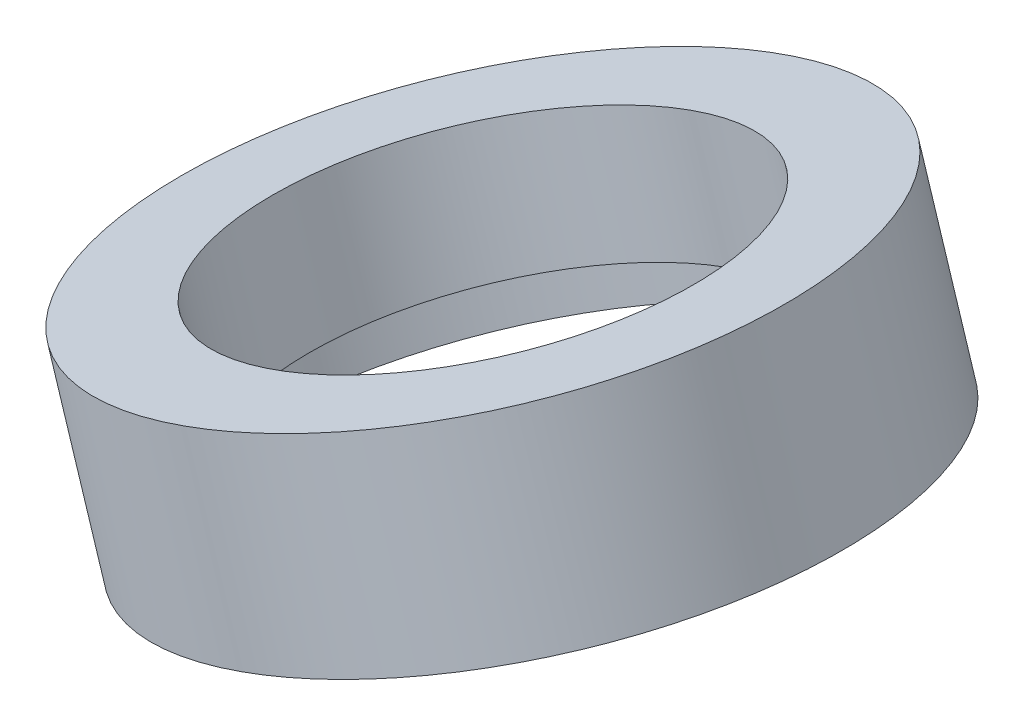
from build123d import *


with BuildPart() as part:
    # Sk_Cazoleta → Cazoleta (revolve)
    with BuildSketch(Plane.XY):
        Polygon((373.42025708, 555.043071141), (379.333285591, 556.907499694), (383.092214125, 544.986071244), (382.233871276, 544.71542839), (380.880657004, 549.007142632), (375.825971342, 547.413356934), align=None)
    revolve(axis=Axis((358.278571521, 555.511428279, 0), (0.3007142826457746, -0.9537142759825068, 0)))


solid = part.part
